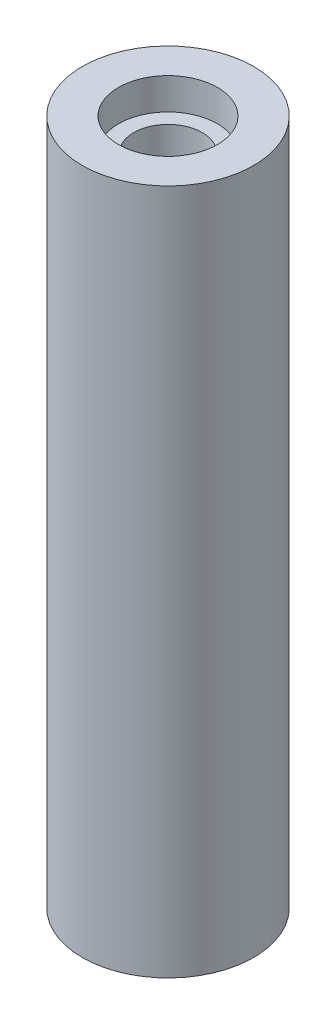
from build123d import *

# Parameters (mm, degrees)
SKETCH1_R           = 19.05
SKETCH1_R_2         = 7.62
BOSS_EXTRUDE1_DEPTH = 152.4
SKETCH3_R           = 11
CUT_EXTRUDE2_DEPTH  = 7
CUT_EXTRUDE3_START  = -7
SKETCH4_R           = 11
CUT_EXTRUDE3_DEPTH  = 7


with BuildPart() as part:
    # Sketch1 → Boss-Extrude1 (new body)
    with BuildSketch(Plane(origin=(0, 0, 0), x_dir=(1, 0, 0), z_dir=(0, 1, 0))):
        Circle(SKETCH1_R)
        Circle(SKETCH1_R_2, mode=Mode.SUBTRACT)
    extrude(amount=BOSS_EXTRUDE1_DEPTH)

    # Sketch3 → Cut-Extrude2 (cut)
    with BuildSketch(Plane(origin=(0, 152.4, 0), x_dir=(1, 0, 0), z_dir=(0, 1, 0))):
        Circle(SKETCH3_R)
    extrude(amount=-CUT_EXTRUDE2_DEPTH, mode=Mode.SUBTRACT)

    # Sketch4 → Cut-Extrude3 (cut)
    with BuildSketch(Plane.XZ.offset(CUT_EXTRUDE3_START)):
        Circle(SKETCH4_R)
    extrude(amount=CUT_EXTRUDE3_DEPTH, mode=Mode.SUBTRACT)


solid = part.part
